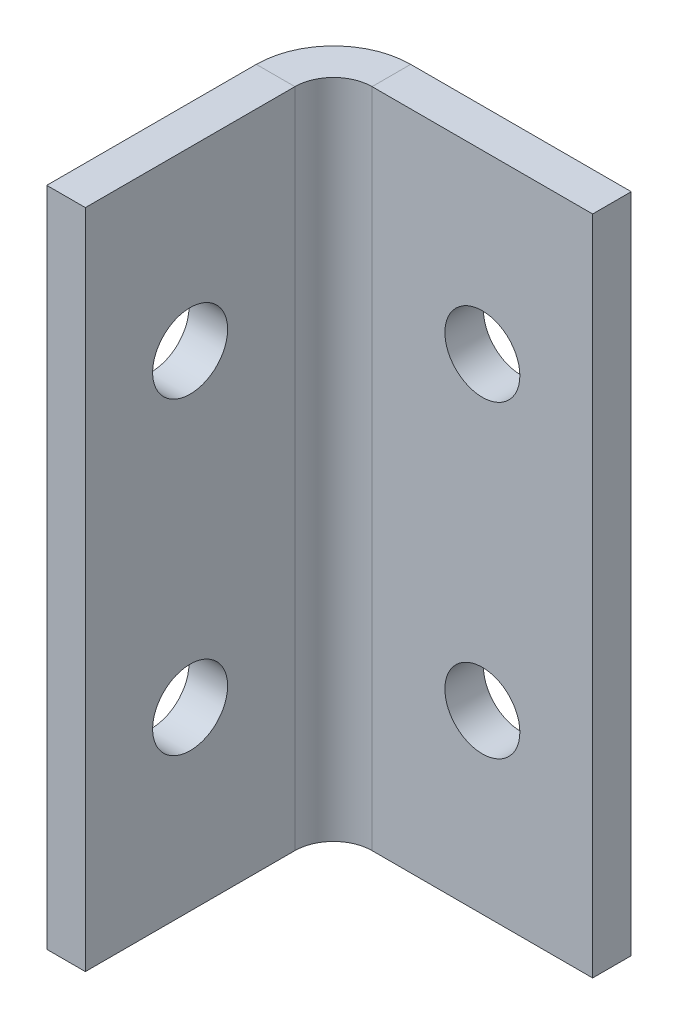
from build123d import *

# Parameters (mm, degrees)
SKETCH1_W                          = 10
SKETCH1_H                          = 30
BASE_FLANGE1_DEPTH                 = 1.75
EDGE_FLANGE1_DEPTH                 = 30
M3_CLEARANCE_HOLE1_D               = 3.4
M3_CLEARANCE_HOLE1_DEPTH           = 5
M3_CLEARANCE_HOLE1_TIP             = 1.021463052
M3_CLEARANCE_HOLE1_ON_FACE_2_D     = 3.4
M3_CLEARANCE_HOLE1_ON_FACE_2_DEPTH = 5
M3_CLEARANCE_HOLE1_ON_FACE_2_TIP   = 1.021463052


# Sheet-metal steps are written as plain solids
with BuildPart() as part:
    # Sketch1 → Base-Flange1 (new body)
    with BuildSketch(Plane.XY):
        with Locations((5, 15)):
            Rectangle(SKETCH1_W, SKETCH1_H)
    extrude(amount=-BASE_FLANGE1_DEPTH)

    # Edge-Flange1 section (across the edge) → Edge-Flange1 (add)
    with BuildSketch(Plane(origin=(-1.75, 30, 0), x_dir=(1, 0, 0), z_dir=(0, -1, 0))):
        with BuildLine():
            Line((-1.75, 1.75), (-1.75, 11.25))
            Line((-1.75, 11.25), (0, 11.25))
            Line((0, 11.25), (0, 1.75))
            ThreePointArc((0, 1.75), (0.512563133, 0.512563133), (1.75, 0))
            Line((1.75, 0), (1.75, -1.75))
            ThreePointArc((1.75, -1.75), (-0.724873734, -0.724873734), (-1.75, 1.75))
        make_face()
    extrude(amount=EDGE_FLANGE1_DEPTH)

    # M3 Clearance Hole1
    with Locations(Plane(origin=(5, 22, 0), x_dir=(1, 0, 0), z_dir=(0, 0, 1))):
        with Locations((0, 0), (0, -14)):
            Hole(M3_CLEARANCE_HOLE1_D / 2, depth=M3_CLEARANCE_HOLE1_DEPTH)
            with Locations((0, 0, -(M3_CLEARANCE_HOLE1_DEPTH + M3_CLEARANCE_HOLE1_TIP / 2))):  # 118° drill point
                Cone(0, M3_CLEARANCE_HOLE1_D / 2, M3_CLEARANCE_HOLE1_TIP, mode=Mode.SUBTRACT)

    # M3 Clearance Hole1 on face 2
    with Locations(Plane(origin=(-1.75, 22, 6.5), x_dir=(0, 0, 1), z_dir=(1, 0, 0))):
        with Locations((0, 0), (0, 14)):
            Hole(M3_CLEARANCE_HOLE1_ON_FACE_2_D / 2, depth=M3_CLEARANCE_HOLE1_ON_FACE_2_DEPTH)
            with Locations((0, 0, -(M3_CLEARANCE_HOLE1_ON_FACE_2_DEPTH + M3_CLEARANCE_HOLE1_ON_FACE_2_TIP / 2))):  # 118° drill point
                Cone(0, M3_CLEARANCE_HOLE1_ON_FACE_2_D / 2, M3_CLEARANCE_HOLE1_ON_FACE_2_TIP, mode=Mode.SUBTRACT)


solid = part.part
